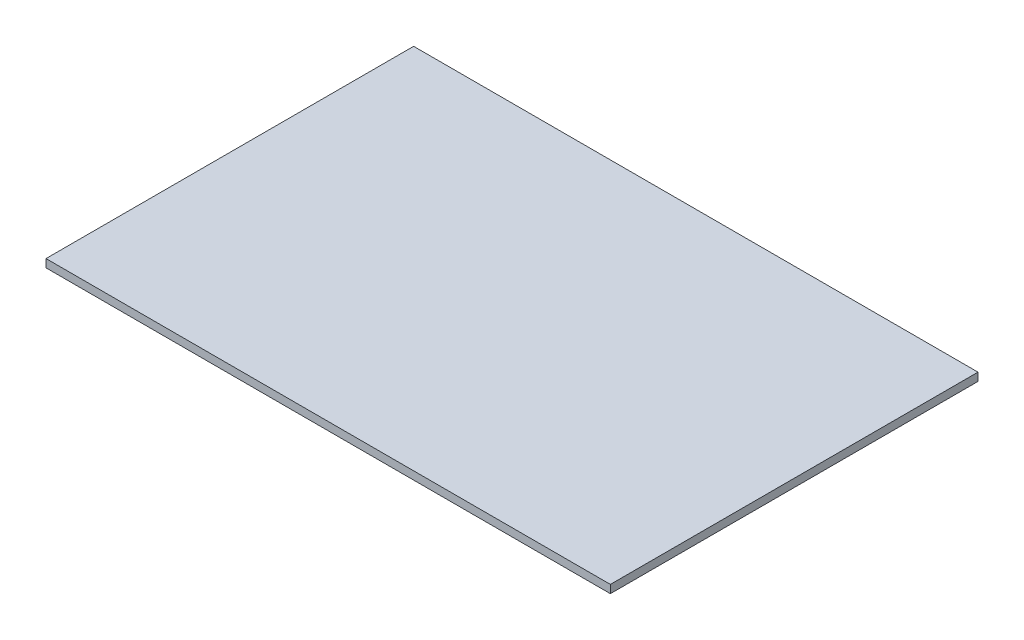
from build123d import *

# Parameters (mm, degrees)
SKETCH1_W           = 111.125
SKETCH1_H           = 72.39
BOSS_EXTRUDE1_DEPTH = 1.5875


with BuildPart() as part:
    # Sketch1 → Boss-Extrude1 (new body)
    with BuildSketch(Plane(origin=(0, 0, 0), x_dir=(1, 0, 0), z_dir=(0, 1, 0))):
        with Locations((55.5625, 36.195)):
            Rectangle(SKETCH1_W, SKETCH1_H)
    extrude(amount=BOSS_EXTRUDE1_DEPTH)


solid = part.part
